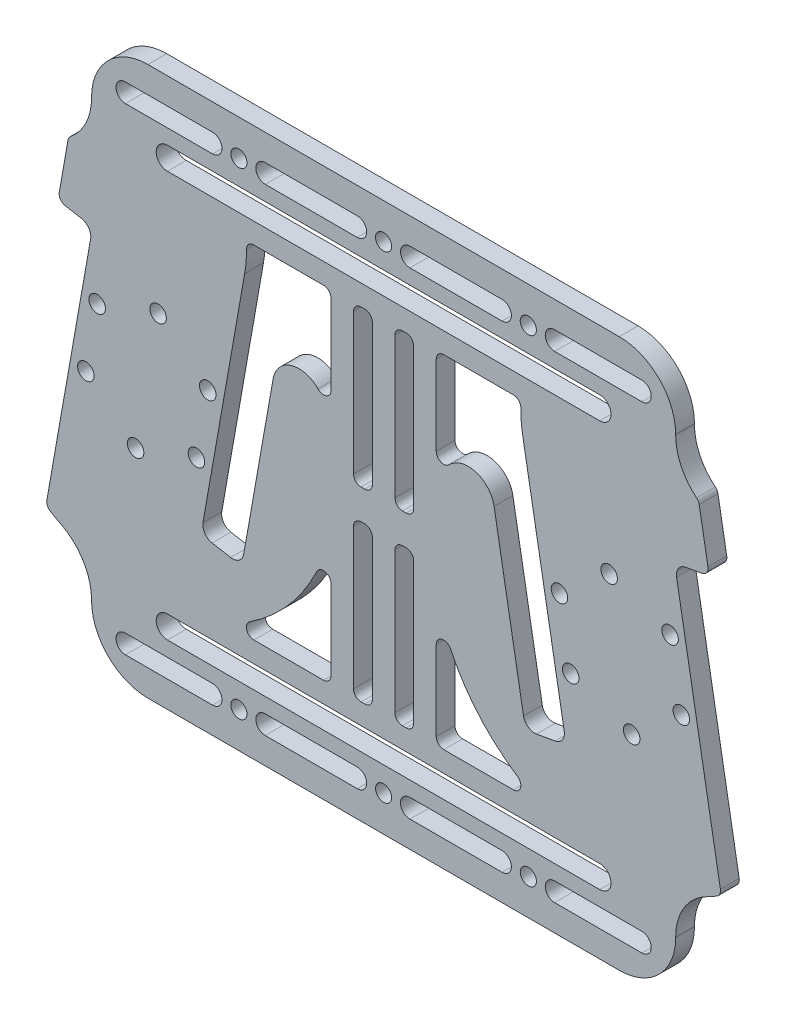
from build123d import *

# Parameters (mm, degrees)
SKETCH_1_R           = 1.9
SKETCH_1_R_2         = 31
EXTRUDE_1_DEPTH      = 5
SKETCH_3_R           = 2.15
CUT_EXTRUDE_2_DEPTH  = 366
CUT_EXTRUDE_START    = -366
CUT_EXTRUDE_3_DEPTH  = 366
FILLET_2_R           = 20
FILLET_3_R           = 35
EXTRUDE_START        = -5
EXTRUDE_5_DEPTH      = 5
CUT_EXTRUDE_START_2  = -5
SKETCH_9_R           = 1.9
CUT_EXTRUDE_6_DEPTH  = 5
CUT_EXTRUDE_7_DEPTH  = 5
FILLET_6_R           = 15
CUT_EXTRUDE_8_DEPTH  = 10
SKETCH_5_W           = 5
SKETCH_5_H           = 41.5
CUT_EXTRUDE_11_DEPTH = 10
FILLET_8_R           = 2
CUT_EXTRUDE_START_3  = -10
SKETCH_16_R          = 1.9
CUT_EXTRUDE_14_DEPTH = 10
EXTRUDE_6_DEPTH      = 5
SKETCH_19_R          = 1.9
SKETCH_19_R_2        = 31
EXTRUDE_7_DEPTH      = 5
SKETCH_20_R          = 2.2
CUT_EXTRUDE_15_DEPTH = 5
CUT_EXTRUDE_16_DEPTH = 39
FILLET_9_R           = 3
CUT_EXTRUDE_17_DEPTH = 10
FILLET_10_R          = 30
FILLET_11_R          = 7
CUT_EXTRUDE_21_DEPTH = 10
FILLET_15_R          = 15
CUT_EXTRUDE_22_DEPTH = 10
FILLET_16_R          = 2
FILLET_17_R          = 6
FILLET_18_R          = 2
CUT_EXTRUDE_23_DEPTH = 10
FILLET_19_R          = 2


with BuildPart() as part:
    # 草图1 → 凸台-拉伸1 (new body)
    with BuildSketch(Plane.XY):
        with BuildLine():
            Line((126, 86), (0, 86))
            ThreePointArc((0, 86), (-86, 0), (0, -86))
            Line((0, -86), (126, -86))
            ThreePointArc((126, -86), (212, 0), (126, 86))
        make_face()
        with BuildLine():
            ThreePointArc((1.615549442, -43.5), (0, -46.4), (-1.615549442, -43.5))
            ThreePointArc((-1.615549442, -43.5), (0, -40.6), (1.615549442, -43.5))
        make_face(mode=Mode.SUBTRACT)
        with Locations((-31.466251763, -31.466251763)):
            Circle(SKETCH_1_R, mode=Mode.SUBTRACT)
        with Locations((-42.5, 0)):
            Circle(SKETCH_1_R, mode=Mode.SUBTRACT)
        with Locations((31.466251763, -31.466251763)):
            Circle(SKETCH_1_R, mode=Mode.SUBTRACT)
        with Locations((42.5, 0)):
            Circle(SKETCH_1_R, mode=Mode.SUBTRACT)
        with BuildLine():
            ThreePointArc((127.615549442, -43.5), (126, -46.4), (124.384450558, -43.5))
            ThreePointArc((124.384450558, -43.5), (126, -40.6), (127.615549442, -43.5))
        make_face(mode=Mode.SUBTRACT)
        with Locations((94.533748237, -31.466251763)):
            Circle(SKETCH_1_R, mode=Mode.SUBTRACT)
        with BuildLine():
            ThreePointArc((82.5, 1.615549442), (85.4, 0), (82.5, -1.615549442))
            ThreePointArc((82.5, -1.615549442), (79.6, 0), (82.5, 1.615549442))
        make_face(mode=Mode.SUBTRACT)
        with Locations((157.466251763, -31.466251763)):
            Circle(SKETCH_1_R, mode=Mode.SUBTRACT)
        with BuildLine():
            ThreePointArc((169.5, -1.615549442), (166.6, 0), (169.5, 1.615549442))
            ThreePointArc((169.5, 1.615549442), (172.4, 0), (169.5, -1.615549442))
        make_face(mode=Mode.SUBTRACT)
        with Locations((-31.466251763, 31.466251763)):
            Circle(SKETCH_1_R, mode=Mode.SUBTRACT)
        Circle(SKETCH_1_R_2, mode=Mode.SUBTRACT)
        with Locations((31.466251763, 31.466251763)):
            Circle(SKETCH_1_R, mode=Mode.SUBTRACT)
        with BuildLine():
            ThreePointArc((-1.615549442, 43.5), (0, 46.4), (1.615549442, 43.5))
            ThreePointArc((1.615549442, 43.5), (0, 40.6), (-1.615549442, 43.5))
        make_face(mode=Mode.SUBTRACT)
        with Locations((126, 0)):
            Circle(SKETCH_1_R_2, mode=Mode.SUBTRACT)
        with Locations((94.533748237, 31.466251763)):
            Circle(SKETCH_1_R, mode=Mode.SUBTRACT)
        with Locations((157.466251763, 31.466251763)):
            Circle(SKETCH_1_R, mode=Mode.SUBTRACT)
        with BuildLine():
            ThreePointArc((124.384450558, 43.5), (126, 46.4), (127.615549442, 43.5))
            ThreePointArc((127.615549442, 43.5), (126, 40.6), (124.384450558, 43.5))
        make_face(mode=Mode.SUBTRACT)
    extrude(amount=EXTRUDE_1_DEPTH)

    # 草图3 → 切除-拉伸2 (cut)
    with BuildSketch(Plane.XY.offset(5)):
        with Locations((24.5, 63.5)):
            Circle(SKETCH_3_R)
        with Locations((63, 63.5)):
            Circle(SKETCH_3_R)
        with Locations((101.5, 63.5)):
            Circle(SKETCH_3_R)
        with Locations((24.5, -63.5)):
            Circle(SKETCH_3_R)
        with Locations((63, -63.5)):
            Circle(SKETCH_3_R)
        with Locations((101.5, -63.5)):
            Circle(SKETCH_3_R)
    extrude(amount=-CUT_EXTRUDE_2_DEPTH, mode=Mode.SUBTRACT)

    # 草图4 → 切除-拉伸3 (cut)
    with BuildSketch(Plane.XY.offset(5).offset(CUT_EXTRUDE_START)):
        with BuildLine():
            Line((0, -86), (126, -86))
            ThreePointArc((126, -86), (212, 0), (126, 86))
            Line((126, 86), (0, 86))
            ThreePointArc((0, 86), (-86, 0), (0, -86))
        make_face()
        Polygon((-15.138102704, 73), (141.138102704, 73), (190, 32), (190, -32), (141.138102704, -73), (-15.138102704, -73), (-64, -32), (-64, 32), align=None, mode=Mode.SUBTRACT)
    extrude(amount=CUT_EXTRUDE_3_DEPTH, mode=Mode.SUBTRACT)

    # 圆角2
    fillet_2_edges = [part.edges().sort_by_distance(p)[0] for p in [
        (-15.138102704, -73, 2.5),
        (-15.138102704, 73, 2.5),
        (141.138102704, 73, 2.5),
        (141.138102704, -73, 2.5),
    ]]
    fillet(fillet_2_edges, radius=FILLET_2_R)

    # 圆角3
    fillet_3_edges = [part.edges().sort_by_distance(p)[0] for p in [
        (-64, -32, 2.5),
        (-64, 32, 2.5),
        (190, 32, 2.5),
        (190, -32, 2.5),
    ]]
    fillet(fillet_3_edges, radius=FILLET_3_R)

    # 草图8 → 凸台-拉伸5 (add)
    with BuildSketch(Plane.XY.offset(5).offset(EXTRUDE_START)):
        with BuildLine():
            ThreePointArc((1.615549442, 43.5), (0, 46.4), (-1.615549442, 43.5))
            ThreePointArc((-1.615549442, 43.5), (0, 44.4), (1.615549442, 43.5))
        make_face()
        with BuildLine():
            ThreePointArc((-43.5, -1.615549442), (-40.6, 0), (-43.5, 1.615549442))
            ThreePointArc((-43.5, 1.615549442), (-42.6, 0), (-43.5, -1.615549442))
        make_face()
        with BuildLine():
            ThreePointArc((-1.615549442, -43.5), (0, -46.4), (1.615549442, -43.5))
            ThreePointArc((1.615549442, -43.5), (0, -44.4), (-1.615549442, -43.5))
        make_face()
        with BuildLine():
            ThreePointArc((43.5, -1.615549442), (42.6, 0), (43.5, 1.615549442))
            ThreePointArc((43.5, 1.615549442), (40.6, 0), (43.5, -1.615549442))
        make_face()
        with BuildLine():
            ThreePointArc((124.384450558, -43.5), (126, -46.4), (127.615549442, -43.5))
            ThreePointArc((127.615549442, -43.5), (126, -44.4), (124.384450558, -43.5))
        make_face()
        with BuildLine():
            ThreePointArc((82.5, -1.615549442), (85.4, 0), (82.5, 1.615549442))
            ThreePointArc((82.5, 1.615549442), (83.4, 0), (82.5, -1.615549442))
        make_face()
        with BuildLine():
            ThreePointArc((169.5, -1.615549442), (168.6, 0), (169.5, 1.615549442))
            ThreePointArc((169.5, 1.615549442), (166.6, 0), (169.5, -1.615549442))
        make_face()
        with BuildLine():
            ThreePointArc((124.384450558, 43.5), (126, 44.4), (127.615549442, 43.5))
            ThreePointArc((127.615549442, 43.5), (126, 46.4), (124.384450558, 43.5))
        make_face()
    extrude(amount=EXTRUDE_5_DEPTH)

    # 草图9 → 切除-拉伸6 (cut)
    with BuildSketch(Plane.XY.offset(5).offset(CUT_EXTRUDE_START_2)):
        with Locations((-42.5, 0)):
            Circle(SKETCH_9_R)
        with Locations((42.5, 0)):
            Circle(SKETCH_9_R)
    extrude(amount=CUT_EXTRUDE_6_DEPTH, mode=Mode.SUBTRACT)

    # 草图11 → 切除-拉伸7 (cut)
    with BuildSketch(Plane(origin=(0, 0, 0), x_dir=(-1, 0, 0), z_dir=(0, 0, -1)).offset(CUT_EXTRUDE_START_2)):
        with BuildLine():
            Line((-140.699100885, 47.79054753), (-140.699100885, 71.793852416))
            ThreePointArc((-140.699100885, 71.793852416), (-143.858698018, 70.320508076), (-146.714450212, 68.320888862))
            Line((-146.714450212, 68.320888862), (-177.497566339, 42.490787474))
            ThreePointArc((-177.497566339, 42.490787474), (-186.720772546, 30.470871125), (-190, 15.679231965))
            Line((-190, 15.679231965), (-190, -15.679231965))
            ThreePointArc((-190, -15.679231965), (-186.720772546, -30.470871125), (-177.497566339, -42.490787474))
            Line((-177.497566339, -42.490787474), (-146.714450212, -68.320888862))
            ThreePointArc((-146.714450212, -68.320888862), (-143.858698018, -70.320508076), (-140.699100885, -71.793852416))
            Line((-140.699100885, -71.793852416), (-140.699100885, -47.79054753))
            ThreePointArc((-140.699100885, -47.79054753), (-176, 0), (-140.699100885, 47.79054753))
        make_face()
        with BuildLine():
            ThreePointArc((20.714450212, 68.320888862), (17.858698018, 70.320508076), (14.699100885, 71.793852416))
            Line((14.699100885, 71.793852416), (14.699100885, 47.79054753))
            ThreePointArc((14.699100885, 47.79054753), (40.217875654, 29.70727988), (50, 0))
            ThreePointArc((50, 0), (40.217875654, -29.70727988), (14.699100885, -47.79054753))
            Line((14.699100885, -47.79054753), (14.699100885, -71.793852416))
            ThreePointArc((14.699100885, -71.793852416), (17.858698018, -70.320508076), (20.714450212, -68.320888862))
            Line((20.714450212, -68.320888862), (51.497566339, -42.490787474))
            ThreePointArc((51.497566339, -42.490787474), (60.720772546, -30.470871125), (64, -15.679231965))
            Line((64, -15.679231965), (64, 15.679231965))
            ThreePointArc((64, 15.679231965), (60.720772546, 30.470871125), (51.497566339, 42.490787474))
            Line((51.497566339, 42.490787474), (20.714450212, 68.320888862))
        make_face()
    extrude(amount=CUT_EXTRUDE_7_DEPTH, mode=Mode.SUBTRACT)

    # 圆角6
    # the kernel refuses this fillet: 15 mm, written as the material it takes off along each edge
    with BuildSketch(Plane(origin=(140.699100885, 71.793852416, 42.621037332), x_dir=(0, -1, 0), z_dir=(0, 0, -1))) as fillet_6_piece_1:
        with BuildLine():
            CenterArc((13.793852416, 15), FILLET_6_R, 180, 90)
            Line((-1.206147584, 15), (-2.706147584, 15))
            ThreePointArc((-2.706147584, 15), (-2.706147584, 6.840402867), (-1.409538931, -0.513030215))
            Line((-1.409538931, -0.513030215), (0, -1.5))
            Line((0, -1.5), (13.793852416, -1.5))
            Line((13.793852416, -1.5), (13.793852416, 0))
        make_face()
    extrude(amount=80.242074665, mode=Mode.SUBTRACT)
    with BuildSketch(Plane(origin=(-14.699100885, 71.793852416, 42.621037332), x_dir=(0, -1, 0), z_dir=(0, 0, -1)), Plane(origin=(140.699100885, -71.793852416, 42.621037332), x_dir=(0, 1, 0), z_dir=(0, 0, -1))) as fillet_6_piece_2:
        with BuildLine():
            CenterArc((13.793852416, -15), FILLET_6_R, 90, 90)
            Line((-1.206147584, -15), (-2.706147584, -15))
            ThreePointArc((-2.706147584, -15), (-2.706147584, -6.840402867), (-1.409538931, 0.513030215))
            Line((-1.409538931, 0.513030215), (0, 1.5))
            Line((0, 1.5), (13.793852416, 1.5))
            Line((13.793852416, 1.5), (13.793852416, 0))
        make_face()
    extrude(amount=80.242074665, mode=Mode.SUBTRACT)
    with BuildSketch(Plane(origin=(-14.699100885, -71.793852416, 42.621037332), x_dir=(0.99678272208778, -0.08015113815333846, 0), z_dir=(0, 0, -1))) as fillet_6_piece_3:
        with BuildLine():
            CenterArc((13.846147861, -14.951740831), FILLET_6_R, 85.402746789, 90)
            Line((-1.105592971, -13.749473759), (-2.600767054, -13.629247052))
            Line((-2.600767054, -13.629247052), (-1.495174083, 0.120226707))
            Line((-1.495174083, 0.120226707), (-0.398403505, 1.446124008))
            ThreePointArc((-0.398403505, 1.446124008), (7.035296198, 2.14917508), (15.16864164, 1.495174083))
            Line((15.16864164, 1.495174083), (15.048414933, 0))
        make_face()
    extrude(amount=80.242074665, mode=Mode.SUBTRACT)

    # 草图14 → 切除-拉伸8 (cut)
    with BuildSketch(Plane.XY.offset(5)):
        with BuildLine():
            Line((-5.699100885, 66), (17.5, 66))
            ThreePointArc((17.5, 66), (20, 63.5), (17.5, 61))
            Line((17.5, 61), (-5.699100885, 61))
            ThreePointArc((-5.699100885, 61), (-8.199100885, 63.5), (-5.699100885, 66))
        make_face()
        with BuildLine():
            Line((31.5, 66), (56, 66))
            ThreePointArc((56, 66), (58.5, 63.5), (56, 61))
            Line((56, 61), (31.5, 61))
            ThreePointArc((31.5, 61), (29, 63.5), (31.5, 66))
        make_face()
        with BuildLine():
            Line((94.5, 66), (70, 66))
            ThreePointArc((70, 66), (67.5, 63.5), (70, 61))
            Line((70, 61), (94.5, 61))
            ThreePointArc((94.5, 61), (97, 63.5), (94.5, 66))
        make_face()
        with BuildLine():
            Line((131.699100885, 66), (108.5, 66))
            ThreePointArc((108.5, 66), (106, 63.5), (108.5, 61))
            Line((108.5, 61), (131.699100885, 61))
            ThreePointArc((131.699100885, 61), (134.199100885, 63.5), (131.699100885, 66))
        make_face()
        with BuildLine():
            Line((5.5, 57), (120.5, 57))
            ThreePointArc((120.5, 57), (123.5, 54), (120.5, 51))
            Line((120.5, 51), (5.5, 51))
            ThreePointArc((5.5, 51), (2.5, 54), (5.5, 57))
        make_face()
    cut_extrude_8 = extrude(amount=-CUT_EXTRUDE_8_DEPTH, mode=Mode.SUBTRACT)

    # 草图5 → 切除-拉伸11 (cut)
    with BuildSketch(Plane.XY.offset(5)):
        with BuildLine():
            Line((49, 9.949874371), (49, 45.5))
            Line((49, 45.5), (20.730412442, 45.5))
            ThreePointArc((20.730412442, 45.5), (39.134836947, 31.120162871), (49, 9.949874371))
        make_face()
        with Locations((57.5, 24.75)):
            Rectangle(SKETCH_5_W, SKETCH_5_H)
        with Locations((68.5, 24.75)):
            Rectangle(SKETCH_5_W, SKETCH_5_H)
        with BuildLine():
            Line((105.269587558, 45.5), (77, 45.5))
            Line((77, 45.5), (77, 9.949874371))
            ThreePointArc((77, 9.949874371), (86.865163053, 31.120162871), (105.269587558, 45.5))
        make_face()
        with Locations((68.5, -24.75)):
            Rectangle(SKETCH_5_W, SKETCH_5_H)
        with Locations((57.5, -24.75)):
            Rectangle(SKETCH_5_W, SKETCH_5_H)
        with BuildLine():
            Line((77, -45.5), (105.269587558, -45.5))
            ThreePointArc((105.269587558, -45.5), (86.865163053, -31.120162871), (77, -9.949874371))
            Line((77, -9.949874371), (77, -45.5))
        make_face()
        with BuildLine():
            ThreePointArc((49, -9.949874371), (39.134836947, -31.120162871), (20.730412442, -45.5))
            Line((20.730412442, -45.5), (49, -45.5))
            Line((49, -45.5), (49, -9.949874371))
        make_face()
    extrude(amount=-CUT_EXTRUDE_11_DEPTH, mode=Mode.SUBTRACT)

    # 圆角8
    fillet_8_edges = [part.edges().sort_by_distance(p)[0] for p in [
        (66, -45.5, 2.5),
        (66, -4, 2.5),
        (71, -4, 2.5),
        (71, -45.5, 2.5),
        (105.269587558, 45.5, 2.5),
        (77, 9.949874371, 2.5),
        (77, 45.5, 2.5),
        (66, 45.5, 2.5),
        (71, 45.5, 2.5),
        (71, 4, 2.5),
        (66, 4, 2.5),
        (55, 45.5, 2.5),
        (60, 45.5, 2.5),
        (60, 4, 2.5),
        (55, 4, 2.5),
        (55, -45.5, 2.5),
        (55, -4, 2.5),
        (60, -4, 2.5),
        (60, -45.5, 2.5),
        (77, -9.949874371, 2.5),
        (105.269587558, -45.5, 2.5),
        (77, -45.5, 2.5),
        (20.730412442, -45.5, 2.5),
        (49, -9.949874371, 2.5),
        (49, -45.5, 2.5),
        (49, 9.949874371, 2.5),
        (20.730412442, 45.5, 2.5),
        (49, 45.5, 2.5),
    ]]
    fillet(fillet_8_edges, radius=FILLET_8_R)

    # 镜向1: 切除-拉伸8 across plane
    add(cut_extrude_8.mirror(Plane.ZX), mode=Mode.SUBTRACT)

    # 草图16 → 切除-拉伸14 (cut)
    with BuildSketch(Plane.XY.offset(5).offset(CUT_EXTRUDE_START_3)):
        with Locations((42.5, 0)):
            Circle(SKETCH_16_R)
        with Locations((44.5, 0)):
            Circle(SKETCH_16_R)
        with Locations((-42.5, 0)):
            Circle(SKETCH_16_R)
        with Locations((-44.5, 0)):
            Circle(SKETCH_16_R)
    extrude(amount=CUT_EXTRUDE_14_DEPTH, mode=Mode.SUBTRACT)

    # 凸台-拉伸6: read off the stored shape, not the designer's step
    # 凸台-拉伸6 outline → 凸台-拉伸6 (add)
    with BuildSketch(Plane.XY.offset(5).offset(EXTRUDE_START)):
        with BuildLine():
            ThreePointArc((43.5, -1.615549442), (42.6, 0), (43.5, 1.615549442))
            ThreePointArc((43.5, 1.615549442), (40.6, 0), (43.5, -1.615549442))
        make_face()
        with BuildLine():
            ThreePointArc((-43.5, 1.615549442), (-42.6, 0), (-43.5, -1.615549442))
            ThreePointArc((-43.5, -1.615549442), (-40.6, 0), (-43.5, 1.615549442))
        make_face()
    extrude(amount=EXTRUDE_6_DEPTH)

    # 草图19 → 凸台-拉伸7 (add)
    with BuildSketch(Plane.XY.offset(5).offset(EXTRUDE_START)):
        with Locations((126, -42.5)):
            Circle(SKETCH_19_R)
        with Locations((157.466251763, -31.466251763)):
            Circle(SKETCH_19_R)
        with Locations((170.5, 0)):
            Circle(SKETCH_19_R)
        with Locations((157.466251763, 31.466251763)):
            Circle(SKETCH_19_R)
        with Locations((126, 42.5)):
            Circle(SKETCH_19_R)
        with Locations((94.533748237, 31.466251763)):
            Circle(SKETCH_19_R)
        with Locations((81.5, 0)):
            Circle(SKETCH_19_R)
        with Locations((94.533748237, -31.466251763)):
            Circle(SKETCH_19_R)
        with Locations((-44.5, 0)):
            Circle(SKETCH_19_R)
        with Locations((-31.466251763, 31.466251763)):
            Circle(SKETCH_19_R)
        with Locations((0, 42.5)):
            Circle(SKETCH_19_R)
        with Locations((31.466251763, 31.466251763)):
            Circle(SKETCH_19_R)
        with Locations((44.5, 0)):
            Circle(SKETCH_19_R)
        with Locations((31.466251763, -31.466251763)):
            Circle(SKETCH_19_R)
        with Locations((0, -42.5)):
            Circle(SKETCH_19_R)
        with Locations((-31.466251763, -31.466251763)):
            Circle(SKETCH_19_R)
        Circle(SKETCH_19_R_2)
        with Locations((126, 0)):
            Circle(SKETCH_19_R_2)
    extrude(amount=EXTRUDE_7_DEPTH)

    # 草图20 → 切除-拉伸15 (cut)
    with BuildSketch(Plane.XY.offset(5)):
        with Locations((-2.995431065, -16.987933739)):
            Circle(SKETCH_20_R)
        with Locations((2.995431065, 16.987933739)):
            Circle(SKETCH_20_R)
        with Locations((16.209697709, 5.899847472)):
            Circle(SKETCH_20_R)
        with Locations((13.214266644, -11.088086267)):
            Circle(SKETCH_20_R)
        with Locations((-16.209697709, -5.899847472)):
            Circle(SKETCH_20_R)
        with Locations((-13.214266644, 11.088086267)):
            Circle(SKETCH_20_R)
        with Locations((128.995431065, -16.987933739)):
            Circle(SKETCH_20_R)
        with Locations((112.785733356, -11.088086267)):
            Circle(SKETCH_20_R)
        with Locations((109.790302291, 5.899847472)):
            Circle(SKETCH_20_R)
        with Locations((123.004568935, 16.987933739)):
            Circle(SKETCH_20_R)
        with Locations((139.214266644, 11.088086267)):
            Circle(SKETCH_20_R)
        with Locations((142.209697709, -5.899847472)):
            Circle(SKETCH_20_R)
    extrude(amount=-CUT_EXTRUDE_15_DEPTH, mode=Mode.SUBTRACT)

    # 草图21 → 切除-拉伸16 (cut)
    with BuildSketch(Plane.XY.offset(5)):
        Polygon((-14.425211596, 28.183075957), (-23.194444569, -21.54971557), (-34.027329852, -19.639585616), (-25.25809688, 30.093205911), align=None)
        Polygon((34.027329852, 19.639585616), (25.25809688, -30.093205911), (14.425211596, -28.183075957), (23.194444569, 21.54971557), align=None)
        Polygon((102.805555431, 21.54971557), (91.972670148, 19.639585616), (100.74190312, -30.093205911), (111.574788404, -28.183075957), align=None)
        Polygon((151.25809688, 30.093205911), (160.027329852, -19.639585616), (149.194444569, -21.54971557), (140.425211596, 28.183075957), align=None)
    extrude(amount=-CUT_EXTRUDE_16_DEPTH, mode=Mode.SUBTRACT)

    # 圆角9
    fillet_9_edges = [part.edges().sort_by_distance(p)[0] for p in [
        (-25.25809688, 30.093205911, 2.5),
        (-14.425211596, 28.183075957, 2.5),
        (-23.194444569, -21.54971557, 2.5),
        (-34.027329852, -19.639585616, 2.5),
        (23.194444569, 21.54971557, 2.5),
        (34.027329852, 19.639585616, 2.5),
        (25.25809688, -30.093205911, 2.5),
        (14.425211596, -28.183075957, 2.5),
        (102.805555431, 21.54971557, 2.5),
        (111.574788404, -28.183075957, 2.5),
        (100.74190312, -30.093205911, 2.5),
        (91.972670148, 19.639585616, 2.5),
        (140.425211596, 28.183075957, 2.5),
        (151.25809688, 30.093205911, 2.5),
        (160.027329852, -19.639585616, 2.5),
        (149.194444569, -21.54971557, 2.5),
    ]]
    fillet(fillet_9_edges, radius=FILLET_9_R)

    # 草图22 → 切除-拉伸17 (cut)
    with BuildSketch(Plane.XY.offset(5).offset(CUT_EXTRUDE_START_3)):
        with BuildLine():
            Line((25.779041413, -27.138782652), (33.506385319, 16.685162357))
            Line((33.506385319, 16.685162357), (37.875173173, 41.46178949))
            Line((37.875173173, 41.46178949), (27.04228789, 43.371919445))
            Line((27.04228789, 43.371919445), (22.673500036, 18.595292311))
            Line((22.673500036, 18.595292311), (14.946156129, -25.228652698))
            ThreePointArc((14.946156129, -25.228652698), (15.443123256, -27.47032654), (17.379634855, -28.70402049))
            Line((17.379634855, -28.70402049), (22.303673621, -29.572261378))
            ThreePointArc((22.303673621, -29.572261378), (24.545347463, -29.075294252), (25.779041413, -27.138782652))
        make_face()
    cut_extrude_17 = extrude(amount=CUT_EXTRUDE_17_DEPTH, mode=Mode.SUBTRACT)

    # 镜向2: 切除-拉伸17 across plane
    add(cut_extrude_17.mirror(Plane(origin=(63, 0, 0), x_dir=(0, 0, 1), z_dir=(1, 0, 0))), mode=Mode.SUBTRACT)

    # 圆角10
    fillet_10_edges = [part.edges().sort_by_distance(p)[0] for p in [
        (26.860662696, 42.341871784, 2.5),
        (99.139337304, 42.341871784, 2.5),
    ]]
    fillet(fillet_10_edges, radius=FILLET_10_R)

    # 圆角11
    fillet_11_edges = [part.edges().sort_by_distance(p)[0] for p in [
        (36.57558288, 34.091446684, 2.5),
        (89.42441712, 34.091446684, 2.5),
    ]]
    fillet(fillet_11_edges, radius=FILLET_11_R)

    # 草图25 → 切除-拉伸21 (cut)
    with BuildSketch(Plane.XY.offset(5)):
        with BuildLine():
            ThreePointArc((-36.57558288, -34.091446684), (-31.962184924, -38.450211116), (-26.833783249, -42.189430863))
            Line((-26.833783249, -42.189430863), (-14.946156129, 25.228652698))
            Line((-14.946156129, 25.228652698), (-25.779041413, 27.138782652))
            Line((-25.779041413, 27.138782652), (-36.57558288, -34.091446684))
        make_face()
    cut_extrude_21 = extrude(amount=-CUT_EXTRUDE_21_DEPTH, mode=Mode.SUBTRACT)

    # 圆角15
    fillet_15_edges = [part.edges().sort_by_distance(p)[0] for p in [
        (140.699100885, 47.79054753, 2.5),
        (140.699100885, -47.79054753, 2.5),
        (-14.699100885, 47.79054753, 2.5),
        (-14.699100885, -47.79054753, 2.5),
    ]]
    fillet(fillet_15_edges, radius=FILLET_15_R)

    # 草图26 → 切除-拉伸22 (cut)
    with BuildSketch(Plane.XY.offset(5)):
        with BuildLine():
            Line((-36.57558288, -34.091446684), (-26.473634123, 23.19955164))
            Line((-26.473634123, 23.19955164), (-42.674091887, 26.056129444))
            ThreePointArc((-42.674091887, 26.056129444), (-49.744954178, -5.043761872), (-36.57558288, -34.091446684))
        make_face()
    cut_extrude_22 = extrude(amount=-CUT_EXTRUDE_22_DEPTH, mode=Mode.SUBTRACT)

    # 镜向6: 切除-拉伸21, 切除-拉伸22 across plane
    add(cut_extrude_21.mirror(Plane(origin=(63, 0, 0), x_dir=(0, 0, 1), z_dir=(1, 0, 0))), mode=Mode.SUBTRACT)
    add(cut_extrude_22.mirror(Plane(origin=(63, 0, 0), x_dir=(0, 0, 1), z_dir=(1, 0, 0))), mode=Mode.SUBTRACT)

    # 圆角16
    fillet_16_edges = [part.edges().sort_by_distance(p)[0] for p in [
        (-26.473634123, 23.19955164, 2.5),
        (152.473634123, 23.19955164, 2.5),
    ]]
    fillet(fillet_16_edges, radius=FILLET_16_R)

    # 圆角17
    fillet_17_edges = [part.edges().sort_by_distance(p)[0] for p in [
        (-42.674091887, 26.056129444, 2.5),
        (168.674091887, 26.056129444, 2.5),
    ]]
    fillet(fillet_17_edges, radius=FILLET_17_R)

    # 圆角18
    fillet_18_edges = [part.edges().sort_by_distance(p)[0] for p in [
        (-26.833783249, -42.189430863, 2.5),
        (152.833783249, -42.189430863, 2.5),
    ]]
    fillet(fillet_18_edges, radius=FILLET_18_R)

    # 草图27 → 切除-拉伸23 (cut)
    with BuildSketch(Plane.XY.offset(5).offset(CUT_EXTRUDE_START_3)):
        with BuildLine():
            Line((-23.692496863, 29.489559998), (-20.830463446, 45.720958079))
            ThreePointArc((-20.830463446, 45.720958079), (-21.813342859, 45.058474572), (-22.845462219, 44.475665886))
            ThreePointArc((-22.845462219, 44.475665886), (-30.001062296, 39.999203256), (-36.301736139, 34.382902049))
            ThreePointArc((-36.301736139, 34.382902049), (-37.642820175, 28.375236603), (-32.987416868, 24.348107285))
            Line((-32.987416868, 24.348107285), (-28.443249629, 23.546847996))
            ThreePointArc((-28.443249629, 23.546847996), (-26.948800401, 23.878159413), (-26.126337768, 25.169167146))
            Line((-26.126337768, 25.169167146), (-25.779041413, 27.138782652))
            ThreePointArc((-25.779041413, 27.138782652), (-25.068284041, 28.609310787), (-23.692496863, 29.489559998))
        make_face()
        with BuildLine():
            Line((146.830463446, 45.720958079), (149.692496863, 29.489559998))
            ThreePointArc((149.692496863, 29.489559998), (151.068284041, 28.609310787), (151.779041413, 27.138782652))
            Line((151.779041413, 27.138782652), (152.126337768, 25.169167146))
            ThreePointArc((152.126337768, 25.169167146), (152.948800401, 23.878159413), (154.443249629, 23.546847996))
            Line((154.443249629, 23.546847996), (158.987416868, 24.348107285))
            ThreePointArc((158.987416868, 24.348107285), (163.642820175, 28.375236603), (162.301736139, 34.382902049))
            ThreePointArc((162.301736139, 34.382902049), (156.001062296, 39.999203256), (148.845462219, 44.475665886))
            ThreePointArc((148.845462219, 44.475665886), (147.813342859, 45.058474572), (146.830463446, 45.720958079))
        make_face()
    extrude(amount=CUT_EXTRUDE_23_DEPTH, mode=Mode.SUBTRACT)

    # 圆角19
    fillet_19_edges = [part.edges().sort_by_distance(p)[0] for p in [
        (-20.830463446, 45.720958079, 2.5),
        (-23.692496863, 29.489559998, 2.5),
        (146.830463446, 45.720958079, 2.5),
        (149.692496863, 29.489559998, 2.5),
    ]]
    fillet(fillet_19_edges, radius=FILLET_19_R)


solid = part.part
